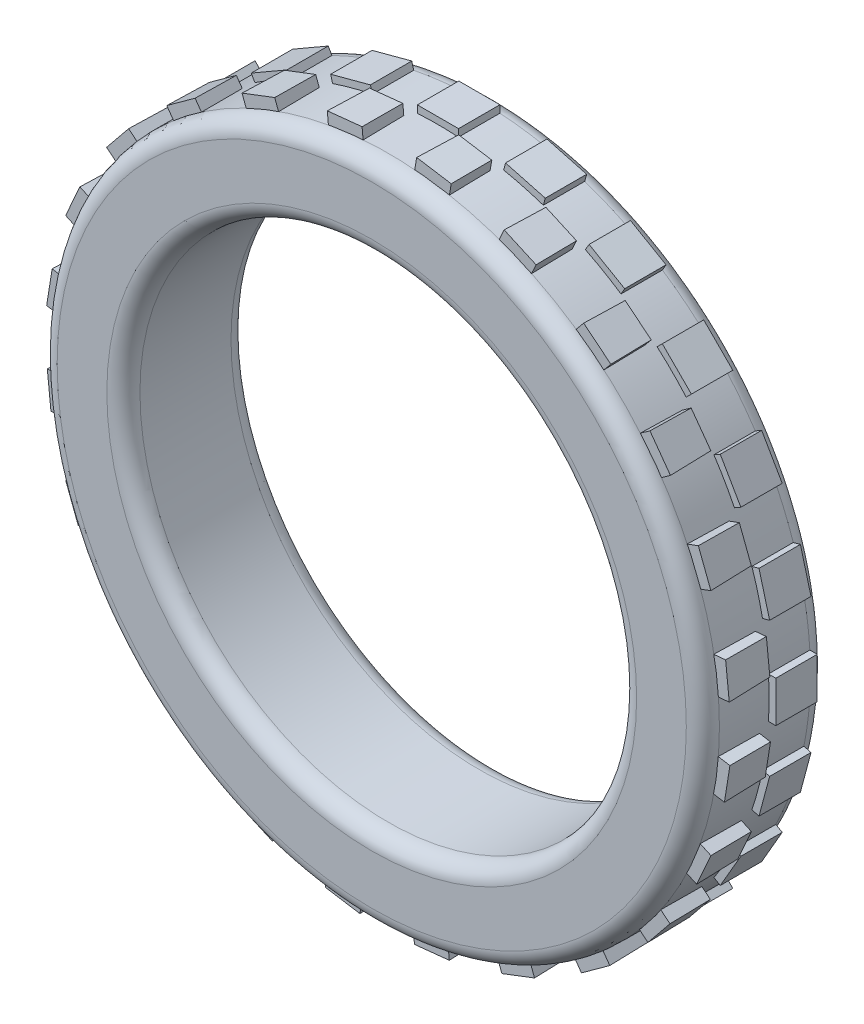
from build123d import *

# Parameters (mm, degrees)
SKETCH1_R              = 4
SKETCH1_R_2            = 3
BOSS_EXTRUDE1_DEPTH    = 1.5
FILLET1_R              = 0.2
FILLET2_R              = 0.2
SKETCH3_W              = 0.252859155
SKETCH3_H              = 0.49676818
SKETCH3_W_2            = 0.49676818
SKETCH3_H_2            = 0.252859155
BOSS_EXTRUDE5_DEPTH    = 0.5
BOSS_EXTRUDE6_DEPTH    = 0.5001
BOSS_EXTRUDE6_DRAFT    = -1
BOSS_EXTRUDE6_2_DEPTH  = 0.5001
BOSS_EXTRUDE6_2_DRAFT  = -1
BOSS_EXTRUDE6_3_DEPTH  = 0.5001
BOSS_EXTRUDE6_3_DRAFT  = -1
BOSS_EXTRUDE6_4_DEPTH  = 0.5001
BOSS_EXTRUDE6_4_DRAFT  = -1
BOSS_EXTRUDE6_5_DEPTH  = 0.5001
BOSS_EXTRUDE6_5_DRAFT  = -1
BOSS_EXTRUDE6_6_DEPTH  = 0.5001
BOSS_EXTRUDE6_6_DRAFT  = -1
BOSS_EXTRUDE6_7_DEPTH  = 0.5001
BOSS_EXTRUDE6_7_DRAFT  = -1
BOSS_EXTRUDE6_8_DEPTH  = 0.5001
BOSS_EXTRUDE6_8_DRAFT  = -1
BOSS_EXTRUDE6_9_DEPTH  = 0.5001
BOSS_EXTRUDE6_9_DRAFT  = -1
BOSS_EXTRUDE6_10_DEPTH = 0.5001
BOSS_EXTRUDE6_10_DRAFT = -1
BOSS_EXTRUDE6_11_DEPTH = 0.5001
BOSS_EXTRUDE6_11_DRAFT = -1
BOSS_EXTRUDE6_12_DEPTH = 0.5001
BOSS_EXTRUDE6_12_DRAFT = -1
BOSS_EXTRUDE6_13_DEPTH = 0.5001
BOSS_EXTRUDE6_13_DRAFT = -1
BOSS_EXTRUDE6_14_DEPTH = 0.5001
BOSS_EXTRUDE6_14_DRAFT = -1
BOSS_EXTRUDE6_15_DEPTH = 0.5001
BOSS_EXTRUDE6_15_DRAFT = -1
BOSS_EXTRUDE6_16_DEPTH = 0.5001
BOSS_EXTRUDE6_16_DRAFT = -1
BOSS_EXTRUDE6_17_DEPTH = 0.5001
BOSS_EXTRUDE6_17_DRAFT = -1
BOSS_EXTRUDE6_18_DEPTH = 0.5001
BOSS_EXTRUDE6_18_DRAFT = -1
BOSS_EXTRUDE6_19_DEPTH = 0.5001
BOSS_EXTRUDE6_19_DRAFT = -1
BOSS_EXTRUDE6_20_DEPTH = 0.5001
BOSS_EXTRUDE6_20_DRAFT = -1
BOSS_EXTRUDE6_21_DEPTH = 0.5001
BOSS_EXTRUDE6_21_DRAFT = -1
BOSS_EXTRUDE6_22_DEPTH = 0.5001
BOSS_EXTRUDE6_22_DRAFT = -1
BOSS_EXTRUDE6_23_DEPTH = 0.5001
BOSS_EXTRUDE6_23_DRAFT = -1
BOSS_EXTRUDE6_24_DEPTH = 0.5001
BOSS_EXTRUDE6_24_DRAFT = -1


# Read off the part's stored shape, not the designer's step: Boss-Extrude6
with BuildPart() as part:
    # Sketch1 → Boss-Extrude1 (new body)
    with BuildSketch(Plane.XY):
        Circle(SKETCH1_R)
        Circle(SKETCH1_R_2, mode=Mode.SUBTRACT)
    extrude(amount=BOSS_EXTRUDE1_DEPTH)

    # Fillet1
    fillet1_edges = [part.edges().sort_by_distance(p)[0] for p in [
        (-4, 0, 0),
        (-4, 0, 1.5),
    ]]
    fillet(fillet1_edges, radius=FILLET1_R)

    # Fillet2
    fillet2_edges = [part.edges().sort_by_distance(p)[0] for p in [
        (-3, 0, 0),
        (-3, 0, 1.5),
    ]]
    fillet(fillet2_edges, radius=FILLET2_R)

    # Sketch3 → Boss-Extrude5 (add)
    with BuildSketch(Plane.XY.offset(0.2)):
        with Locations((3.954724749, 0)):
            Rectangle(SKETCH3_W, SKETCH3_H)
        Polygon((3.633562643, -1.230756307), (3.762135709, -0.750915093), (4.006378897, -0.816359858), (3.877805831, -1.296201072), align=None)
        Polygon((3.191208826, -2.129254517), (3.439592916, -1.699040654), (3.658575368, -1.825470231), (3.410191278, -2.255684094), align=None)
        Polygon((2.531379401, -2.88264755), (2.88264755, -2.531379401), (3.061445973, -2.710177825), (2.710177825, -3.061445973), align=None)
        Polygon((1.699040654, -3.439592916), (2.129254517, -3.191208826), (2.255684094, -3.410191278), (1.825470231, -3.658575368), align=None)
        Polygon((0.750915093, -3.762135709), (1.230756307, -3.633562643), (1.296201072, -3.877805831), (0.816359858, -4.006378897), align=None)
        with Locations((0, -3.954724749)):
            Rectangle(SKETCH3_W_2, SKETCH3_H_2)
        Polygon((-1.230756307, -3.633562643), (-0.750915093, -3.762135709), (-0.816359858, -4.006378897), (-1.296201072, -3.877805831), align=None)
        Polygon((-2.129254517, -3.191208826), (-1.699040654, -3.439592916), (-1.825470231, -3.658575368), (-2.255684094, -3.410191278), align=None)
        Polygon((-2.88264755, -2.531379401), (-2.531379401, -2.88264755), (-2.710177825, -3.061445973), (-3.061445973, -2.710177825), align=None)
        Polygon((-3.439592916, -1.699040654), (-3.191208826, -2.129254517), (-3.410191278, -2.255684094), (-3.658575368, -1.825470231), align=None)
        Polygon((-3.762135709, -0.750915093), (-3.633562643, -1.230756307), (-3.877805831, -1.296201072), (-4.006378897, -0.816359858), align=None)
        with Locations((-3.954724749, 0)):
            Rectangle(SKETCH3_W, SKETCH3_H)
        Polygon((-3.633562643, 1.230756307), (-3.762135709, 0.750915093), (-4.006378897, 0.816359858), (-3.877805831, 1.296201072), align=None)
        Polygon((-3.191208826, 2.129254517), (-3.439592916, 1.699040654), (-3.658575368, 1.825470231), (-3.410191278, 2.255684094), align=None)
        Polygon((-2.531379401, 2.88264755), (-2.88264755, 2.531379401), (-3.061445973, 2.710177825), (-2.710177825, 3.061445973), align=None)
        Polygon((-1.699040654, 3.439592916), (-2.129254517, 3.191208826), (-2.255684094, 3.410191278), (-1.825470231, 3.658575368), align=None)
        Polygon((-0.750915093, 3.762135709), (-1.230756307, 3.633562643), (-1.296201072, 3.877805831), (-0.816359858, 4.006378897), align=None)
        with Locations((0, 3.954724749)):
            Rectangle(SKETCH3_W_2, SKETCH3_H_2)
        Polygon((1.230756307, 3.633562643), (0.750915093, 3.762135709), (0.816359858, 4.006378897), (1.296201072, 3.877805831), align=None)
        Polygon((2.129254517, 3.191208826), (1.699040654, 3.439592916), (1.825470231, 3.658575368), (2.255684094, 3.410191278), align=None)
        Polygon((2.88264755, 2.531379401), (2.531379401, 2.88264755), (2.710177825, 3.061445973), (3.061445973, 2.710177825), align=None)
        Polygon((3.439592916, 1.699040654), (3.191208826, 2.129254517), (3.410191278, 2.255684094), (3.658575368, 1.825470231), align=None)
        Polygon((3.762135709, 0.750915093), (3.633562643, 1.230756307), (3.877805831, 1.296201072), (4.006378897, 0.816359858), align=None)
    extrude(amount=BOSS_EXTRUDE5_DEPTH)


with BuildPart() as body_2:
    # Boss-Extrude6 outline → Boss-Extrude6 (with draft: the straight prism first)
    with BuildSketch(Plane.XY.offset(0.8)):
        Polygon((-4.109140199, -0.324344668), (-4.067169357, -0.727253589), (-3.837233587, -0.705784652), (-3.879204429, -0.30287573), align=None)
    extrude(amount=BOSS_EXTRUDE6_DEPTH)
    # Boss-Extrude6: the draft: its side faces are tilted about the plane it starts from
    boss_extrude6_sides = [body_2.faces().sort_by_distance(p)[0] for p in [
        (-4.088154778, -0.525799128, 1.05005),
        (-3.952201472, -0.71651912, 1.05005),
        (-3.858219008, -0.504330191, 1.05005),
        (-3.994172314, -0.313610199, 1.05005),
    ]]
    draft(boss_extrude6_sides, Plane.XY.offset(0.8), BOSS_EXTRUDE6_DRAFT)


with BuildPart() as body_3:
    # Boss-Extrude6 2 outline → Boss-Extrude6 2 (with draft: the straight prism first)
    with BuildSketch(Plane.XY.offset(0.8)):
        Polygon((-3.885178065, -1.376816634), (-3.740356843, -1.755133913), (-3.523812514, -1.674884756), (-3.668633736, -1.296567476), align=None)
    extrude(amount=BOSS_EXTRUDE6_2_DEPTH)
    # Boss-Extrude6 2: the draft: its side faces are tilted about the plane it starts from
    boss_extrude6_2_sides = [body_3.faces().sort_by_distance(p)[0] for p in [
        (-3.812767454, -1.565975274, 1.05005),
        (-3.632084678, -1.715009334, 1.05005),
        (-3.596223125, -1.485726116, 1.05005),
        (-3.776905901, -1.336692055, 1.05005),
    ]]
    draft(boss_extrude6_2_sides, Plane.XY.offset(0.8), BOSS_EXTRUDE6_2_DRAFT)


with BuildPart() as body_4:
    # Boss-Extrude6 3 outline → Boss-Extrude6 3 (with draft: the straight prism first)
    with BuildSketch(Plane.XY.offset(0.8)):
        Polygon((-3.396447466, -2.335460821), (-3.15864519, -2.663404762), (-2.970249441, -2.529844232), (-3.208051716, -2.201900291), align=None)
    extrude(amount=BOSS_EXTRUDE6_3_DEPTH)
    # Boss-Extrude6 3: the draft: its side faces are tilted about the plane it starts from
    boss_extrude6_3_sides = [body_4.faces().sort_by_distance(p)[0] for p in [
        (-3.277546328, -2.499432791, 1.05005),
        (-3.064447315, -2.596624497, 1.05005),
        (-3.089150578, -2.365872261, 1.05005),
        (-3.302249591, -2.268680556, 1.05005),
    ]]
    draft(boss_extrude6_3_sides, Plane.XY.offset(0.8), BOSS_EXTRUDE6_3_DRAFT)


with BuildPart() as body_5:
    # Boss-Extrude6 4 outline → Boss-Extrude6 4 (with draft: the straight prism first)
    with BuildSketch(Plane.XY.offset(0.8)):
        Polygon((-2.676254586, -3.134947214), (-2.361677088, -3.390168977), (-2.214268777, -3.212399004), (-2.528846274, -2.95717724), align=None)
    extrude(amount=BOSS_EXTRUDE6_4_DEPTH)
    # Boss-Extrude6 4: the draft: its side faces are tilted about the plane it starts from
    boss_extrude6_4_sides = [body_5.faces().sort_by_distance(p)[0] for p in [
        (-2.518965837, -3.262558096, 1.05005),
        (-2.287972932, -3.30128399, 1.05005),
        (-2.371557526, -3.084788122, 1.05005),
        (-2.60255043, -3.046062227, 1.05005),
    ]]
    draft(boss_extrude6_4_sides, Plane.XY.offset(0.8), BOSS_EXTRUDE6_4_DRAFT)


with BuildPart() as body_6:
    # Boss-Extrude6 5 outline → Boss-Extrude6 5 (with draft: the straight prism first)
    with BuildSketch(Plane.XY.offset(0.8)):
        Polygon((-1.773679378, -3.720792134), (-1.403764595, -3.88589878), (-1.307389355, -3.676034093), (-1.677304138, -3.510927447), align=None)
    extrude(amount=BOSS_EXTRUDE6_5_DEPTH)
    # Boss-Extrude6 5: the draft: its side faces are tilted about the plane it starts from
    boss_extrude6_5_sides = [body_6.faces().sort_by_distance(p)[0] for p in [
        (-1.588721986, -3.803345457, 1.05005),
        (-1.355576975, -3.780966437, 1.05005),
        (-1.492346746, -3.59348077, 1.05005),
        (-1.725491758, -3.61585979, 1.05005),
    ]]
    draft(boss_extrude6_5_sides, Plane.XY.offset(0.8), BOSS_EXTRUDE6_5_DRAFT)


with BuildPart() as body_7:
    # Boss-Extrude6 6 outline → Boss-Extrude6 6 (with draft: the straight prism first)
    with BuildSketch(Plane.XY.offset(0.8)):
        Polygon((-0.750230851, -4.053071219), (-0.350187865, -4.116811002), (-0.31141351, -3.889153533), (-0.711456496, -3.82541375), align=None)
    extrude(amount=BOSS_EXTRUDE6_6_DEPTH)
    # Boss-Extrude6 6: the draft: its side faces are tilted about the plane it starts from
    boss_extrude6_6_sides = [body_7.faces().sort_by_distance(p)[0] for p in [
        (-0.550209358, -4.08494111, 1.05005),
        (-0.330800688, -4.002982268, 1.05005),
        (-0.511435003, -3.857283642, 1.05005),
        (-0.730843674, -3.939242484, 1.05005),
    ]]
    draft(boss_extrude6_6_sides, Plane.XY.offset(0.8), BOSS_EXTRUDE6_6_DRAFT)


with BuildPart() as body_8:
    # Boss-Extrude6 7 outline → Boss-Extrude6 7 (with draft: the straight prism first)
    with BuildSketch(Plane.XY.offset(0.8)):
        Polygon((0.324344668, -4.109140199), (0.727253589, -4.067169357), (0.705784652, -3.837233587), (0.30287573, -3.879204429), align=None)
    extrude(amount=BOSS_EXTRUDE6_7_DEPTH)
    # Boss-Extrude6 7: the draft: its side faces are tilted about the plane it starts from
    boss_extrude6_7_sides = [body_8.faces().sort_by_distance(p)[0] for p in [
        (0.525799128, -4.088154778, 1.05005),
        (0.71651912, -3.952201472, 1.05005),
        (0.504330191, -3.858219008, 1.05005),
        (0.313610199, -3.994172314, 1.05005),
    ]]
    draft(boss_extrude6_7_sides, Plane.XY.offset(0.8), BOSS_EXTRUDE6_7_DRAFT)


with BuildPart() as body_9:
    # Boss-Extrude6 8 outline → Boss-Extrude6 8 (with draft: the straight prism first)
    with BuildSketch(Plane.XY.offset(0.8)):
        Polygon((1.376816634, -3.885178065), (1.755133913, -3.740356843), (1.674884756, -3.523812514), (1.296567476, -3.668633736), align=None)
    extrude(amount=BOSS_EXTRUDE6_8_DEPTH)
    # Boss-Extrude6 8: the draft: its side faces are tilted about the plane it starts from
    boss_extrude6_8_sides = [body_9.faces().sort_by_distance(p)[0] for p in [
        (1.565975274, -3.812767454, 1.05005),
        (1.715009334, -3.632084678, 1.05005),
        (1.485726116, -3.596223125, 1.05005),
        (1.336692055, -3.776905901, 1.05005),
    ]]
    draft(boss_extrude6_8_sides, Plane.XY.offset(0.8), BOSS_EXTRUDE6_8_DRAFT)


with BuildPart() as body_10:
    # Boss-Extrude6 9 outline → Boss-Extrude6 9 (with draft: the straight prism first)
    with BuildSketch(Plane.XY.offset(0.8)):
        Polygon((2.335460821, -3.396447466), (2.663404762, -3.15864519), (2.529844232, -2.970249441), (2.201900291, -3.208051716), align=None)
    extrude(amount=BOSS_EXTRUDE6_9_DEPTH)
    # Boss-Extrude6 9: the draft: its side faces are tilted about the plane it starts from
    boss_extrude6_9_sides = [body_10.faces().sort_by_distance(p)[0] for p in [
        (2.499432791, -3.277546328, 1.05005),
        (2.596624497, -3.064447315, 1.05005),
        (2.365872261, -3.089150578, 1.05005),
        (2.268680556, -3.302249591, 1.05005),
    ]]
    draft(boss_extrude6_9_sides, Plane.XY.offset(0.8), BOSS_EXTRUDE6_9_DRAFT)


with BuildPart() as body_11:
    # Boss-Extrude6 10 outline → Boss-Extrude6 10 (with draft: the straight prism first)
    with BuildSketch(Plane.XY.offset(0.8)):
        Polygon((3.134947214, -2.676254586), (3.390168977, -2.361677088), (3.212399004, -2.214268777), (2.95717724, -2.528846274), align=None)
    extrude(amount=BOSS_EXTRUDE6_10_DEPTH)
    # Boss-Extrude6 10: the draft: its side faces are tilted about the plane it starts from
    boss_extrude6_10_sides = [body_11.faces().sort_by_distance(p)[0] for p in [
        (3.262558096, -2.518965837, 1.05005),
        (3.30128399, -2.287972932, 1.05005),
        (3.084788122, -2.371557526, 1.05005),
        (3.046062227, -2.60255043, 1.05005),
    ]]
    draft(boss_extrude6_10_sides, Plane.XY.offset(0.8), BOSS_EXTRUDE6_10_DRAFT)


with BuildPart() as body_12:
    # Boss-Extrude6 11 outline → Boss-Extrude6 11 (with draft: the straight prism first)
    with BuildSketch(Plane.XY.offset(0.8)):
        Polygon((3.720792134, -1.773679378), (3.88589878, -1.403764595), (3.676034093, -1.307389355), (3.510927447, -1.677304138), align=None)
    extrude(amount=BOSS_EXTRUDE6_11_DEPTH)
    # Boss-Extrude6 11: the draft: its side faces are tilted about the plane it starts from
    boss_extrude6_11_sides = [body_12.faces().sort_by_distance(p)[0] for p in [
        (3.803345457, -1.588721986, 1.05005),
        (3.780966437, -1.355576975, 1.05005),
        (3.59348077, -1.492346746, 1.05005),
        (3.61585979, -1.725491758, 1.05005),
    ]]
    draft(boss_extrude6_11_sides, Plane.XY.offset(0.8), BOSS_EXTRUDE6_11_DRAFT)


with BuildPart() as body_13:
    # Boss-Extrude6 12 outline → Boss-Extrude6 12 (with draft: the straight prism first)
    with BuildSketch(Plane.XY.offset(0.8)):
        Polygon((4.053071219, -0.750230851), (4.116811002, -0.350187865), (3.889153533, -0.31141351), (3.82541375, -0.711456496), align=None)
    extrude(amount=BOSS_EXTRUDE6_12_DEPTH)
    # Boss-Extrude6 12: the draft: its side faces are tilted about the plane it starts from
    boss_extrude6_12_sides = [body_13.faces().sort_by_distance(p)[0] for p in [
        (4.08494111, -0.550209358, 1.05005),
        (4.002982268, -0.330800688, 1.05005),
        (3.857283642, -0.511435003, 1.05005),
        (3.939242484, -0.730843674, 1.05005),
    ]]
    draft(boss_extrude6_12_sides, Plane.XY.offset(0.8), BOSS_EXTRUDE6_12_DRAFT)


with BuildPart() as body_14:
    # Boss-Extrude6 13 outline → Boss-Extrude6 13 (with draft: the straight prism first)
    with BuildSketch(Plane.XY.offset(0.8)):
        Polygon((4.109140199, 0.324344668), (4.067169357, 0.727253589), (3.837233587, 0.705784652), (3.879204429, 0.30287573), align=None)
    extrude(amount=BOSS_EXTRUDE6_13_DEPTH)
    # Boss-Extrude6 13: the draft: its side faces are tilted about the plane it starts from
    boss_extrude6_13_sides = [body_14.faces().sort_by_distance(p)[0] for p in [
        (4.088154778, 0.525799128, 1.05005),
        (3.952201472, 0.71651912, 1.05005),
        (3.858219008, 0.504330191, 1.05005),
        (3.994172314, 0.313610199, 1.05005),
    ]]
    draft(boss_extrude6_13_sides, Plane.XY.offset(0.8), BOSS_EXTRUDE6_13_DRAFT)


with BuildPart() as body_15:
    # Boss-Extrude6 14 outline → Boss-Extrude6 14 (with draft: the straight prism first)
    with BuildSketch(Plane.XY.offset(0.8)):
        Polygon((3.885178065, 1.376816634), (3.740356843, 1.755133913), (3.523812514, 1.674884756), (3.668633736, 1.296567476), align=None)
    extrude(amount=BOSS_EXTRUDE6_14_DEPTH)
    # Boss-Extrude6 14: the draft: its side faces are tilted about the plane it starts from
    boss_extrude6_14_sides = [body_15.faces().sort_by_distance(p)[0] for p in [
        (3.812767454, 1.565975274, 1.05005),
        (3.632084678, 1.715009334, 1.05005),
        (3.596223125, 1.485726116, 1.05005),
        (3.776905901, 1.336692055, 1.05005),
    ]]
    draft(boss_extrude6_14_sides, Plane.XY.offset(0.8), BOSS_EXTRUDE6_14_DRAFT)


with BuildPart() as body_16:
    # Boss-Extrude6 15 outline → Boss-Extrude6 15 (with draft: the straight prism first)
    with BuildSketch(Plane.XY.offset(0.8)):
        Polygon((3.396447466, 2.335460821), (3.15864519, 2.663404762), (2.970249441, 2.529844232), (3.208051716, 2.201900291), align=None)
    extrude(amount=BOSS_EXTRUDE6_15_DEPTH)
    # Boss-Extrude6 15: the draft: its side faces are tilted about the plane it starts from
    boss_extrude6_15_sides = [body_16.faces().sort_by_distance(p)[0] for p in [
        (3.277546328, 2.499432791, 1.05005),
        (3.064447315, 2.596624497, 1.05005),
        (3.089150578, 2.365872261, 1.05005),
        (3.302249591, 2.268680556, 1.05005),
    ]]
    draft(boss_extrude6_15_sides, Plane.XY.offset(0.8), BOSS_EXTRUDE6_15_DRAFT)


with BuildPart() as body_17:
    # Boss-Extrude6 16 outline → Boss-Extrude6 16 (with draft: the straight prism first)
    with BuildSketch(Plane.XY.offset(0.8)):
        Polygon((2.676254586, 3.134947214), (2.361677088, 3.390168977), (2.214268777, 3.212399004), (2.528846274, 2.95717724), align=None)
    extrude(amount=BOSS_EXTRUDE6_16_DEPTH)
    # Boss-Extrude6 16: the draft: its side faces are tilted about the plane it starts from
    boss_extrude6_16_sides = [body_17.faces().sort_by_distance(p)[0] for p in [
        (2.518965837, 3.262558096, 1.05005),
        (2.287972932, 3.30128399, 1.05005),
        (2.371557526, 3.084788122, 1.05005),
        (2.60255043, 3.046062227, 1.05005),
    ]]
    draft(boss_extrude6_16_sides, Plane.XY.offset(0.8), BOSS_EXTRUDE6_16_DRAFT)


with BuildPart() as body_18:
    # Boss-Extrude6 17 outline → Boss-Extrude6 17 (with draft: the straight prism first)
    with BuildSketch(Plane.XY.offset(0.8)):
        Polygon((1.773679378, 3.720792134), (1.403764595, 3.88589878), (1.307389355, 3.676034093), (1.677304138, 3.510927447), align=None)
    extrude(amount=BOSS_EXTRUDE6_17_DEPTH)
    # Boss-Extrude6 17: the draft: its side faces are tilted about the plane it starts from
    boss_extrude6_17_sides = [body_18.faces().sort_by_distance(p)[0] for p in [
        (1.588721986, 3.803345457, 1.05005),
        (1.355576975, 3.780966437, 1.05005),
        (1.492346746, 3.59348077, 1.05005),
        (1.725491758, 3.61585979, 1.05005),
    ]]
    draft(boss_extrude6_17_sides, Plane.XY.offset(0.8), BOSS_EXTRUDE6_17_DRAFT)


with BuildPart() as body_19:
    # Boss-Extrude6 18 outline → Boss-Extrude6 18 (with draft: the straight prism first)
    with BuildSketch(Plane.XY.offset(0.8)):
        Polygon((0.750230851, 4.053071219), (0.350187865, 4.116811002), (0.31141351, 3.889153533), (0.711456496, 3.82541375), align=None)
    extrude(amount=BOSS_EXTRUDE6_18_DEPTH)
    # Boss-Extrude6 18: the draft: its side faces are tilted about the plane it starts from
    boss_extrude6_18_sides = [body_19.faces().sort_by_distance(p)[0] for p in [
        (0.550209358, 4.08494111, 1.05005),
        (0.330800688, 4.002982268, 1.05005),
        (0.511435003, 3.857283642, 1.05005),
        (0.730843674, 3.939242484, 1.05005),
    ]]
    draft(boss_extrude6_18_sides, Plane.XY.offset(0.8), BOSS_EXTRUDE6_18_DRAFT)


with BuildPart() as body_20:
    # Boss-Extrude6 19 outline → Boss-Extrude6 19 (with draft: the straight prism first)
    with BuildSketch(Plane.XY.offset(0.8)):
        Polygon((-0.324344668, 4.109140199), (-0.727253589, 4.067169357), (-0.705784652, 3.837233587), (-0.30287573, 3.879204429), align=None)
    extrude(amount=BOSS_EXTRUDE6_19_DEPTH)
    # Boss-Extrude6 19: the draft: its side faces are tilted about the plane it starts from
    boss_extrude6_19_sides = [body_20.faces().sort_by_distance(p)[0] for p in [
        (-0.525799128, 4.088154778, 1.05005),
        (-0.71651912, 3.952201472, 1.05005),
        (-0.504330191, 3.858219008, 1.05005),
        (-0.313610199, 3.994172314, 1.05005),
    ]]
    draft(boss_extrude6_19_sides, Plane.XY.offset(0.8), BOSS_EXTRUDE6_19_DRAFT)


with BuildPart() as body_21:
    # Boss-Extrude6 20 outline → Boss-Extrude6 20 (with draft: the straight prism first)
    with BuildSketch(Plane.XY.offset(0.8)):
        Polygon((-1.376816634, 3.885178065), (-1.755133913, 3.740356843), (-1.674884756, 3.523812514), (-1.296567476, 3.668633736), align=None)
    extrude(amount=BOSS_EXTRUDE6_20_DEPTH)
    # Boss-Extrude6 20: the draft: its side faces are tilted about the plane it starts from
    boss_extrude6_20_sides = [body_21.faces().sort_by_distance(p)[0] for p in [
        (-1.565975274, 3.812767454, 1.05005),
        (-1.715009334, 3.632084678, 1.05005),
        (-1.485726116, 3.596223125, 1.05005),
        (-1.336692055, 3.776905901, 1.05005),
    ]]
    draft(boss_extrude6_20_sides, Plane.XY.offset(0.8), BOSS_EXTRUDE6_20_DRAFT)


with BuildPart() as body_22:
    # Boss-Extrude6 21 outline → Boss-Extrude6 21 (with draft: the straight prism first)
    with BuildSketch(Plane.XY.offset(0.8)):
        Polygon((-2.335460821, 3.396447466), (-2.663404762, 3.15864519), (-2.529844232, 2.970249441), (-2.201900291, 3.208051716), align=None)
    extrude(amount=BOSS_EXTRUDE6_21_DEPTH)
    # Boss-Extrude6 21: the draft: its side faces are tilted about the plane it starts from
    boss_extrude6_21_sides = [body_22.faces().sort_by_distance(p)[0] for p in [
        (-2.499432791, 3.277546328, 1.05005),
        (-2.596624497, 3.064447315, 1.05005),
        (-2.365872261, 3.089150578, 1.05005),
        (-2.268680556, 3.302249591, 1.05005),
    ]]
    draft(boss_extrude6_21_sides, Plane.XY.offset(0.8), BOSS_EXTRUDE6_21_DRAFT)


with BuildPart() as body_23:
    # Boss-Extrude6 22 outline → Boss-Extrude6 22 (with draft: the straight prism first)
    with BuildSketch(Plane.XY.offset(0.8)):
        Polygon((-3.134947214, 2.676254586), (-3.390168977, 2.361677088), (-3.212399004, 2.214268777), (-2.95717724, 2.528846274), align=None)
    extrude(amount=BOSS_EXTRUDE6_22_DEPTH)
    # Boss-Extrude6 22: the draft: its side faces are tilted about the plane it starts from
    boss_extrude6_22_sides = [body_23.faces().sort_by_distance(p)[0] for p in [
        (-3.262558096, 2.518965837, 1.05005),
        (-3.30128399, 2.287972932, 1.05005),
        (-3.084788122, 2.371557526, 1.05005),
        (-3.046062227, 2.60255043, 1.05005),
    ]]
    draft(boss_extrude6_22_sides, Plane.XY.offset(0.8), BOSS_EXTRUDE6_22_DRAFT)


with BuildPart() as body_24:
    # Boss-Extrude6 23 outline → Boss-Extrude6 23 (with draft: the straight prism first)
    with BuildSketch(Plane.XY.offset(0.8)):
        Polygon((-3.720792134, 1.773679378), (-3.88589878, 1.403764595), (-3.676034093, 1.307389355), (-3.510927447, 1.677304138), align=None)
    extrude(amount=BOSS_EXTRUDE6_23_DEPTH)
    # Boss-Extrude6 23: the draft: its side faces are tilted about the plane it starts from
    boss_extrude6_23_sides = [body_24.faces().sort_by_distance(p)[0] for p in [
        (-3.803345457, 1.588721986, 1.05005),
        (-3.780966437, 1.355576975, 1.05005),
        (-3.59348077, 1.492346746, 1.05005),
        (-3.61585979, 1.725491758, 1.05005),
    ]]
    draft(boss_extrude6_23_sides, Plane.XY.offset(0.8), BOSS_EXTRUDE6_23_DRAFT)


with BuildPart() as body_25:
    # Boss-Extrude6 24 outline → Boss-Extrude6 24 (with draft: the straight prism first)
    with BuildSketch(Plane.XY.offset(0.8)):
        Polygon((-4.053071219, 0.750230851), (-4.116811002, 0.350187865), (-3.889153533, 0.31141351), (-3.82541375, 0.711456496), align=None)
    extrude(amount=BOSS_EXTRUDE6_24_DEPTH)
    # Boss-Extrude6 24: the draft: its side faces are tilted about the plane it starts from
    boss_extrude6_24_sides = [body_25.faces().sort_by_distance(p)[0] for p in [
        (-4.08494111, 0.550209358, 1.05005),
        (-4.002982268, 0.330800688, 1.05005),
        (-3.857283642, 0.511435003, 1.05005),
        (-3.939242484, 0.730843674, 1.05005),
    ]]
    draft(boss_extrude6_24_sides, Plane.XY.offset(0.8), BOSS_EXTRUDE6_24_DRAFT)


solid = Compound([part.part, body_2.part, body_3.part, body_4.part, body_5.part, body_6.part, body_7.part, body_8.part, body_9.part, body_10.part, body_11.part, body_12.part, body_13.part, body_14.part, body_15.part, body_16.part, body_17.part, body_18.part, body_19.part, body_20.part, body_21.part, body_22.part, body_23.part, body_24.part, body_25.part])
